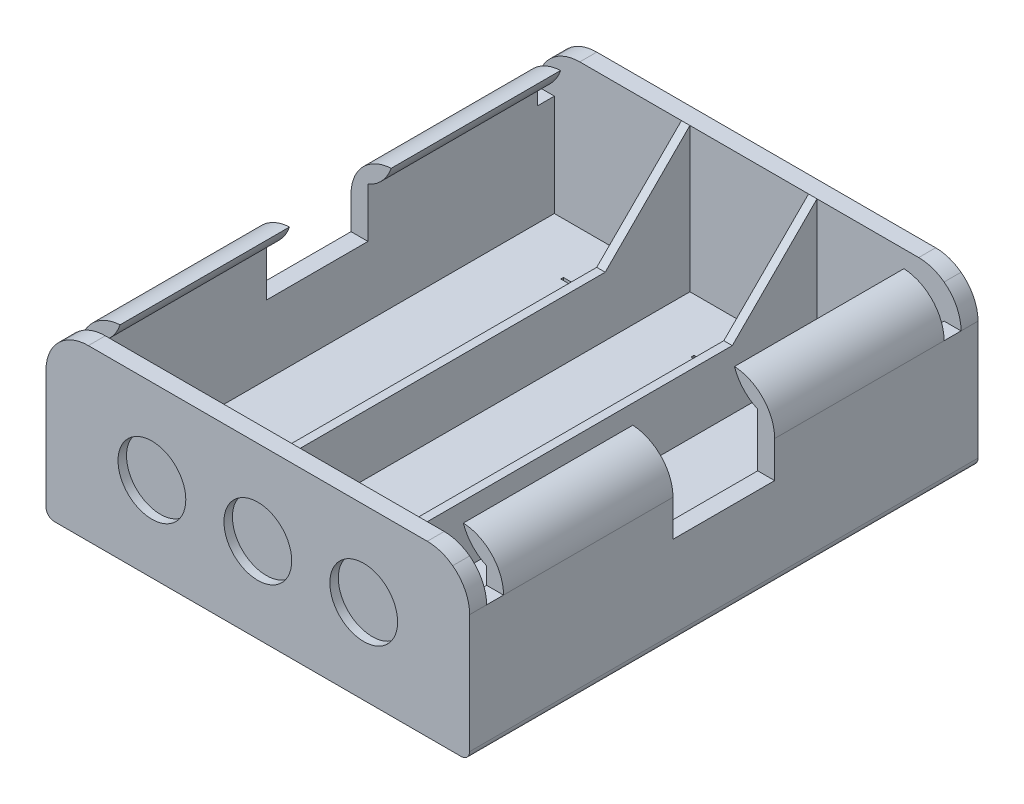
from build123d import *

# Parameters (mm, degrees)
ESQUISSE1_W             = 50
ESQUISSE1_H             = 17
BOSS_EXTRU_1_DEPTH      = 60
ESQUISSE2_W             = 46
ESQUISSE2_H             = 56
ENL_V_MAT_EXTRU_1_DEPTH = 14
ESQUISSE3_W             = 5
ESQUISSE3_H             = 60
BOSS_EXTRU_2_DEPTH      = 3
CONG_4_R                = 5
CONG_5_R                = 5
ESQUISSE4_W             = 6
ESQUISSE4_H             = 6.399260537
ESQUISSE4_H_2           = 4.300369731
ENL_V_MAT_EXTRU_2_DEPTH = 13
ESQUISSE5_W             = 6
ESQUISSE5_H             = 3.853440377
ESQUISSE5_H_2           = 6.397176283
ENL_V_MAT_EXTRU_3_DEPTH = 13
ESQUISSE6_W             = 46
ESQUISSE6_H             = 2
BOSS_EXTRU_3_DEPTH      = 3
CONG_6_R                = 5
CONG_7_R                = 5
CONG_8_R                = 5
ESQUISSE7_W             = 2
ESQUISSE7_H             = 5.210267062
ENL_V_MAT_EXTRU_4_DEPTH = 62
ESQUISSE8_W             = 2
ESQUISSE8_H             = 8.257223626
ENL_V_MAT_EXTRU_5_DEPTH = 62
ESQUISSE9_W             = 1
ESQUISSE9_H             = 56
BOSS_EXTRU_4_DEPTH      = 7
BOSS_EXTRU_5_DEPTH      = 1
BOSS_EXTRU_6_DEPTH      = 1
BOSS_EXTRU_7_DEPTH      = 1
BOSS_EXTRU_8_DEPTH      = 1
ENL_V_MAT_EXTRU_6_DEPTH = 0.5
ESQUISSE19_W            = 1.346153846
ESQUISSE19_H            = 0.358974359
ESQUISSE19_W_2          = 1.346153847
ENL_V_MAT_EXTRU_7_DEPTH = 0.5
CONG_9_R                = 1
CONG_10_R               = 1
ENL_V_MAT_EXTRU_8_DEPTH = 1
ENL_V_START             = -1
ENL_V_MAT_EXTRU_9_DEPTH = 1
ESQUISSE22_W            = 1.5
ESQUISSE22_H            = 1.7
BOSS_EXTRU_9_DEPTH      = 9


# Some blends are built 0.0001 mm under size
with BuildPart() as part:
    # Esquisse1 → Boss.-Extru.1 (new body)
    with BuildSketch(Plane.XY):
        with Locations((-25, 8.5)):
            Rectangle(ESQUISSE1_W, ESQUISSE1_H)
    extrude(amount=BOSS_EXTRU_1_DEPTH)

    # Esquisse2 → Enlèv. mat.-Extru.1 (cut)
    with BuildSketch(Plane(origin=(0, 17, 0), x_dir=(1, 0, 0), z_dir=(0, 1, 0))):
        with Locations((-25, -30)):
            Rectangle(ESQUISSE2_W, ESQUISSE2_H)
    extrude(amount=-ENL_V_MAT_EXTRU_1_DEPTH, mode=Mode.SUBTRACT)

    # Esquisse3 → Boss.-Extru.2 (add)
    with BuildSketch(Plane(origin=(0, 17, 0), x_dir=(1, 0, 0), z_dir=(0, 1, 0))):
        with Locations((-2.5, -30)):
            Rectangle(ESQUISSE3_W, ESQUISSE3_H)
        with Locations((-47.5, -30)):
            Rectangle(ESQUISSE3_W, ESQUISSE3_H)
    extrude(amount=BOSS_EXTRU_2_DEPTH)

    # Congé4
    cong_4_edges = [part.edges().sort_by_distance(p)[0] for p in [
        (-50, 20, 30),
        (0, 20, 30),
    ]]
    fillet(cong_4_edges, radius=CONG_4_R - 0.0001)  # a hair under: the kernel refuses the full size

    # Congé5
    # the kernel refuses this fillet: 5 mm, written as the material it takes off along each edge
    with BuildSketch(Plane(origin=(-45, 17, 69.456439237), x_dir=(0, 1, 0), z_dir=(0, 0, -1))) as cong_5_piece_1:
        with BuildLine():
            CenterArc((4.582575695, -5), CONG_5_R, 90, 66.421821522)
            Line((0, -3), (0, 0))
            Line((0, 0), (4.582575695, 0))
        make_face()
    extrude(amount=78.912878475, mode=Mode.SUBTRACT)
    with BuildSketch(Plane(origin=(-5, 17, 69.456439237), x_dir=(0, 1, 0), z_dir=(0, 0, -1))) as cong_5_piece_2:
        with BuildLine():
            CenterArc((4.582575695, 5), CONG_5_R, 203.578178478, 66.421821522)
            Line((0, 3), (0, 0))
            Line((0, 0), (4.582575695, 0))
        make_face()
    extrude(amount=78.912878475, mode=Mode.SUBTRACT)

    # Esquisse4 → Enlèv. mat.-Extru.2 (cut)
    with BuildSketch(Plane(origin=(0, 0, 0), x_dir=(0, 0, -1), z_dir=(1, 0, 0))):
        with Locations((-27, 18.199630269)):
            Rectangle(ESQUISSE4_W, ESQUISSE4_H)
        with Locations((-27, 12.849815135)):
            Rectangle(ESQUISSE4_W, ESQUISSE4_H_2)
        with Locations((-33, 12.849815135)):
            Rectangle(ESQUISSE4_W, ESQUISSE4_H_2)
        with Locations((-33, 18.199630269)):
            Rectangle(ESQUISSE4_W, ESQUISSE4_H)
    extrude(amount=-ENL_V_MAT_EXTRU_2_DEPTH, mode=Mode.SUBTRACT)

    # Esquisse5 → Enlèv. mat.-Extru.3 (cut)
    with BuildSketch(Plane.ZY.offset(50)):
        with Locations((27, 13.073279812)):
            Rectangle(ESQUISSE5_W, ESQUISSE5_H)
        with Locations((33, 13.073279812)):
            Rectangle(ESQUISSE5_W, ESQUISSE5_H)
        with Locations((33, 18.198588142)):
            Rectangle(ESQUISSE5_W, ESQUISSE5_H_2)
        with Locations((27, 18.198588142)):
            Rectangle(ESQUISSE5_W, ESQUISSE5_H_2)
    extrude(amount=-ENL_V_MAT_EXTRU_3_DEPTH, mode=Mode.SUBTRACT)

    # Esquisse6 → Boss.-Extru.3 (add)
    with BuildSketch(Plane(origin=(0, 17, 0), x_dir=(1, 0, 0), z_dir=(0, 1, 0))):
        with Locations((-25, -1)):
            Rectangle(ESQUISSE6_W, ESQUISSE6_H)
        with Locations((-25, -59)):
            Rectangle(ESQUISSE6_W, ESQUISSE6_H)
    extrude(amount=BOSS_EXTRU_3_DEPTH)

    # Congé6
    # the kernel refuses this fillet: 5 mm, written as the material it takes off along each edge
    with BuildSketch(Plane(origin=(-2, 20, 9.499833331), x_dir=(0, -1, 0), z_dir=(0, 0, -1))) as cong_6_piece_1:
        with BuildLine():
            CenterArc((5, 2.999933333), CONG_6_R, 180, 36.868942712)
            Line((0, 2.999933333), (-0.1, 2.999933333))
            Line((-0.1, 2.999933333), (-0.1, 0))
            Line((-0.1, 0), (0, -0.1))
            ThreePointArc((0, -0.1), (0.499975, -0.1), (0.919949, -0.059998667))
            Line((0.919949, -0.059998667), (0.99995, 0))
        make_face()
    extrude(amount=16.999666663, mode=Mode.SUBTRACT)

    # Congé7
    # the kernel refuses this fillet: 5 mm, written as the material it takes off along each edge
    with BuildSketch(Plane(origin=(-48, 20, -7.499833331), x_dir=(0, -1, 0), z_dir=(0, 0, 1))) as cong_7_piece_1:
        with BuildLine():
            CenterArc((5, 2.999933333), CONG_7_R, 180, 36.868942712)
            Line((0, 2.999933333), (-0.1, 2.999933333))
            Line((-0.1, 2.999933333), (-0.1, 0))
            Line((-0.1, 0), (0, -0.1))
            ThreePointArc((0, -0.1), (0.499975, -0.1), (0.919949, -0.059998667))
            Line((0.919949, -0.059998667), (0.99995, 0))
        make_face()
    extrude(amount=16.999666663, mode=Mode.SUBTRACT)

    # Congé8
    # the kernel refuses this fillet: 5 mm, written as the material it takes off along each edge
    with BuildSketch(Plane(origin=(-2, 20, 67.499833331), x_dir=(0, -1, 0), z_dir=(0, 0, -1))) as cong_8_piece_1:
        with BuildLine():
            CenterArc((5, 2.999933333), CONG_8_R, 180, 36.868942712)
            Line((0, 2.999933333), (-0.1, 2.999933333))
            Line((-0.1, 2.999933333), (-0.1, 0))
            Line((-0.1, 0), (0, -0.1))
            ThreePointArc((0, -0.1), (0.499975, -0.1), (0.919949, -0.059998667))
            Line((0.919949, -0.059998667), (0.99995, 0))
        make_face()
    extrude(amount=16.999666663, mode=Mode.SUBTRACT)
    with BuildSketch(Plane(origin=(-48, 20, 50.500166669), x_dir=(1, 0, 0), z_dir=(0, 0, 1))) as cong_8_piece_2:
        with BuildLine():
            CenterArc((2.999933333, -5), CONG_8_R, 90, 36.868942712)
            Line((0, -0.99995), (-0.059998667, -0.919949))
            ThreePointArc((-0.059998667, -0.919949), (-0.1, -0.499975), (-0.1, 0))
            Line((-0.1, 0), (0, 0.1))
            Line((0, 0.1), (2.999933333, 0.1))
            Line((2.999933333, 0.1), (2.999933333, 0))
        make_face()
    extrude(amount=16.999666663, mode=Mode.SUBTRACT)

    # Esquisse7 → Enlèv. mat.-Extru.4 (cut)
    with BuildSketch(Plane.ZY.offset(50)):
        with Locations((3, 17.605133531)):
            Rectangle(ESQUISSE7_W, ESQUISSE7_H)
    extrude(amount=-ENL_V_MAT_EXTRU_4_DEPTH, mode=Mode.SUBTRACT)

    # Esquisse8 → Enlèv. mat.-Extru.5 (cut)
    with BuildSketch(Plane.ZY.offset(50)):
        with Locations((57, 19.128611813)):
            Rectangle(ESQUISSE8_W, ESQUISSE8_H)
    extrude(amount=-ENL_V_MAT_EXTRU_5_DEPTH, mode=Mode.SUBTRACT)

    # Esquisse9 → Boss.-Extru.4 (add)
    with BuildSketch(Plane(origin=(0, 3, 0), x_dir=(1, 0, 0), z_dir=(0, 1, 0))):
        with Locations((-17.5, -30)):
            Rectangle(ESQUISSE9_W, ESQUISSE9_H)
        with Locations((-32.5, -30)):
            Rectangle(ESQUISSE9_W, ESQUISSE9_H)
    extrude(amount=BOSS_EXTRU_4_DEPTH)

    # Esquisse13 → Boss.-Extru.5 (add)
    with BuildSketch(Plane(origin=(-17, 0, 0), x_dir=(0, 0, -1), z_dir=(1, 0, 0))):
        Polygon((-58, 10), (-48, 10), (-58, 20), align=None)
    extrude(amount=-BOSS_EXTRU_5_DEPTH)

    # Esquisse15 → Boss.-Extru.6 (add)
    with BuildSketch(Plane(origin=(-32, 0, 0), x_dir=(0, 0, -1), z_dir=(1, 0, 0))):
        Polygon((-58, 10), (-48, 10), (-58, 20), align=None)
    extrude(amount=-BOSS_EXTRU_6_DEPTH)

    # Esquisse16 → Boss.-Extru.7 (add)
    with BuildSketch(Plane(origin=(-32, 0, 0), x_dir=(0, 0, -1), z_dir=(1, 0, 0))):
        Polygon((-2, 10), (-12.000546535, 10), (-2, 20.000546535), align=None)
    extrude(amount=-BOSS_EXTRU_7_DEPTH)

    # Esquisse17 → Boss.-Extru.8 (add)
    with BuildSketch(Plane(origin=(-17, 0, 0), x_dir=(0, 0, -1), z_dir=(1, 0, 0))):
        Polygon((-2, 10), (-12, 10), (-2, 20), align=None)
    extrude(amount=-BOSS_EXTRU_8_DEPTH)

    # Esquisse18 → Enlèv. mat.-Extru.6 (cut)
    with BuildSketch(Plane(origin=(0, 3, 0), x_dir=(1, 0, 0), z_dir=(0, 1, 0))):
        Polygon((-8.294815626, -7.258773386), (-8.294815626, -6.226722104), (-7.980713062, -6.226722104), (-7.980713062, -7.258773386), (-6.94866178, -7.258773386), (-6.94866178, -7.57287595), (-7.980713062, -7.57287595), (-7.980713062, -8.604927232), (-8.294815626, -8.604927232), (-8.294815626, -7.57287595), (-9.326866908, -7.57287595), (-9.326866908, -7.258773386), align=None)
        Polygon((-39.900421528, -8.003329449), (-39.900421528, -6.971278167), (-39.586318963, -6.971278167), (-39.586318963, -8.003329449), (-38.554267681, -8.003329449), (-38.554267681, -8.317432014), (-39.586318963, -8.317432014), (-39.586318963, -9.349483296), (-39.900421528, -9.349483296), (-39.900421528, -8.317432014), (-40.93247281, -8.317432014), (-40.93247281, -8.003329449), align=None)
        Polygon((-25.356909486, -51.22098936), (-25.356909486, -50.188938078), (-25.042806922, -50.188938078), (-25.042806922, -51.22098936), (-24.01075564, -51.22098936), (-24.01075564, -51.535091925), (-25.042806922, -51.535091925), (-25.042806922, -52.567143207), (-25.356909486, -52.567143207), (-25.356909486, -51.535091925), (-26.388960769, -51.535091925), (-26.388960769, -51.22098936), align=None)
    extrude(amount=-ENL_V_MAT_EXTRU_6_DEPTH, mode=Mode.SUBTRACT)

    # Esquisse19 → Enlèv. mat.-Extru.7 (cut)
    with BuildSketch(Plane(origin=(0, 3, 0), x_dir=(1, 0, 0), z_dir=(0, 1, 0))):
        with Locations((-40.395987335, -53.05240306)):
            Rectangle(ESQUISSE19_W, ESQUISSE19_H)
        with Locations((-24.593970415, -8.42730727)):
            Rectangle(ESQUISSE19_W, ESQUISSE19_H)
        with Locations((-9.180137719, -53.220847448)):
            Rectangle(ESQUISSE19_W_2, ESQUISSE19_H)
    extrude(amount=-ENL_V_MAT_EXTRU_7_DEPTH, mode=Mode.SUBTRACT)

    # Congé9
    cong_9_edges = [part.edges().sort_by_distance(p)[0] for p in [
        (0, 0, 30),
    ]]
    fillet(cong_9_edges, radius=CONG_9_R)

    # Congé10
    cong_10_edges = [part.edges().sort_by_distance(p)[0] for p in [
        (-50, 0, 30),
    ]]
    fillet(cong_10_edges, radius=CONG_10_R)

    # Esquisse20 → Enlèv. mat.-Extru.8 (cut)
    with BuildSketch(Plane(origin=(0, 0, 0), x_dir=(-1, 0, 0), z_dir=(0, 0, -1))):
        with BuildLine():
            ThreePointArc((12.5, 14), (8.5, 10), (12.5, 6))
            Line((12.5, 6), (12.5, 14))
        make_face()
        with BuildLine():
            Line((12.5, 14), (12.5, 6))
            ThreePointArc((12.5, 6), (15.328427125, 7.171572875), (16.5, 10))
            ThreePointArc((16.5, 10), (15.328427125, 12.828427125), (12.5, 14))
        make_face()
        with BuildLine():
            ThreePointArc((25, 14), (21, 10), (25, 6))
            Line((25, 6), (25, 14))
        make_face()
        with BuildLine():
            Line((25, 14), (25, 6))
            ThreePointArc((25, 6), (27.828427125, 7.171572875), (29, 10))
            ThreePointArc((29, 10), (27.828427125, 12.828427125), (25, 14))
        make_face()
        with BuildLine():
            ThreePointArc((37.5, 14), (33.5, 10), (37.5, 6))
            Line((37.5, 6), (37.5, 14))
        make_face()
        with BuildLine():
            Line((37.5, 14), (37.5, 6))
            ThreePointArc((37.5, 6), (40.328427125, 7.171572875), (41.5, 10))
            ThreePointArc((41.5, 10), (40.328427125, 12.828427125), (37.5, 14))
        make_face()
    extrude(amount=-ENL_V_MAT_EXTRU_8_DEPTH, mode=Mode.SUBTRACT)

    # Esquisse21 → Enlèv. mat.-Extru.9 (cut)
    with BuildSketch(Plane.XY.offset(60).offset(ENL_V_START)):
        with BuildLine():
            ThreePointArc((-37.5, 14), (-41.5, 10), (-37.5, 6))
            Line((-37.5, 6), (-37.5, 14))
        make_face()
        with BuildLine():
            Line((-37.5, 14), (-37.5, 6))
            ThreePointArc((-37.5, 6), (-34.671572875, 7.171572875), (-33.5, 10))
            ThreePointArc((-33.5, 10), (-34.671572875, 12.828427125), (-37.5, 14))
        make_face()
        with BuildLine():
            ThreePointArc((-25, 14), (-29, 10), (-25, 6))
            Line((-25, 6), (-25, 14))
        make_face()
        with BuildLine():
            Line((-25, 14), (-25, 6))
            ThreePointArc((-25, 6), (-22.171572875, 7.171572875), (-21, 10))
            ThreePointArc((-21, 10), (-22.171572875, 12.828427125), (-25, 14))
        make_face()
        with BuildLine():
            ThreePointArc((-12.5, 14), (-16.5, 10), (-12.5, 6))
            Line((-12.5, 6), (-12.5, 14))
        make_face()
        with BuildLine():
            Line((-12.5, 14), (-12.5, 6))
            ThreePointArc((-12.5, 6), (-9.671572875, 7.171572875), (-8.5, 10))
            ThreePointArc((-8.5, 10), (-9.671572875, 12.828427125), (-12.5, 14))
        make_face()
    extrude(amount=ENL_V_MAT_EXTRU_9_DEPTH, mode=Mode.SUBTRACT)

    # Esquisse22 → Boss.-Extru.9 (add)
    with BuildSketch(Plane(origin=(0, 0, 1), x_dir=(-1, 0, 0), z_dir=(0, 0, -1))):
        with Locations((12.5, 4.873394073)):
            Rectangle(ESQUISSE22_W, ESQUISSE22_H)
        with Locations((25, 4.880168725)):
            Rectangle(ESQUISSE22_W, ESQUISSE22_H)
    extrude(amount=BOSS_EXTRU_9_DEPTH)


solid = part.part
